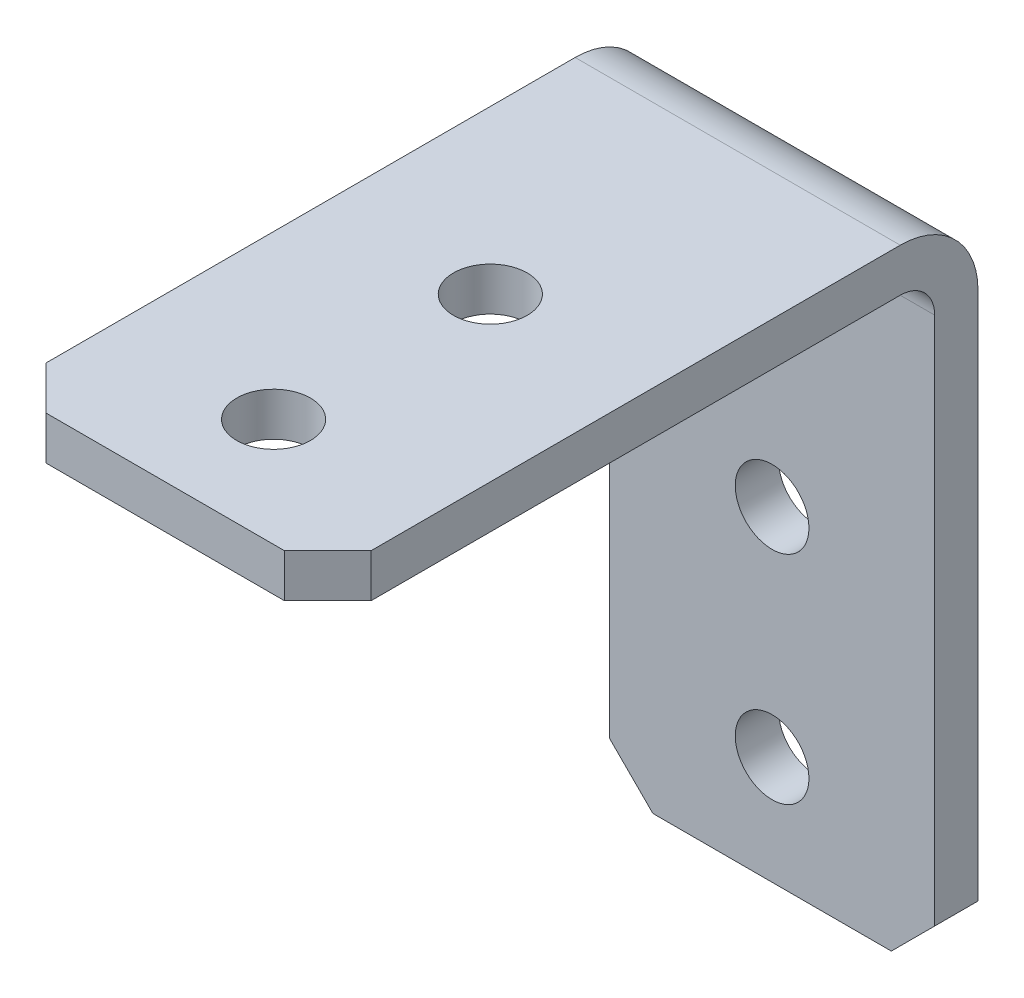
from build123d import *

# Parameters (mm, degrees)
SKETCH1_W                  = 30
SKETCH1_H                  = 30
BOSS_EXTRUDE1_DEPTH        = 15
SKETCH2_W                  = 28
SKETCH2_H                  = 28
CUT_EXTRUDE1_DEPTH         = 36.128336141
F_3_4_3_4_DIAMETER_HOLE1_D = 3.4
F_3_4_3_4_DIAMETER_HOLE2_D = 3.4
CHAMFER1_SIZE              = 2
FILLET1_R                  = 1.5875
FILLET2_R                  = 3.5875


with BuildPart() as part:
    # Sketch1 → Boss-Extrude1 (new body)
    with BuildSketch(Plane(origin=(-7.5, 0, 0), x_dir=(0, -1, 0), z_dir=(-1, 0, 0))):
        with Locations((0, 13)):
            Rectangle(SKETCH1_W, SKETCH1_H)
    extrude(amount=-BOSS_EXTRUDE1_DEPTH)

    # Sketch2 → Cut-Extrude1 (cut, through all)
    with BuildSketch(Plane(origin=(7.5, 0, 0), x_dir=(0, 0, -1), z_dir=(1, 0, 0))):
        with Locations((-14, -1)):
            Rectangle(SKETCH2_W, SKETCH2_H)
    extrude(amount=-CUT_EXTRUDE1_DEPTH, mode=Mode.SUBTRACT)

    # Ø3.4 (3.4) Diameter Hole1 (through all)
    with Locations(Plane.XY):
        with Locations((0, 0), (0, -10)):
            Hole(F_3_4_3_4_DIAMETER_HOLE1_D / 2)

    # Ø3.4 (3.4) Diameter Hole2 (through all)
    with Locations(Plane(origin=(0, 13, 0), x_dir=(-1, 0, 0), z_dir=(0, -1, 0))):
        with Locations((0, -13), (0, -23)):
            Hole(F_3_4_3_4_DIAMETER_HOLE2_D / 2)

    # Chamfer1
    chamfer1_edges = [part.edges().sort_by_distance(p)[0] for p in [
        (7.5, -15, -1),
        (-7.5, 14, 28),
        (7.5, 14, 28),
        (-7.5, -15, -1),
    ]]
    chamfer(chamfer1_edges, length=CHAMFER1_SIZE)

    # Fillet1
    fillet1_edges = [part.edges().sort_by_distance(p)[0] for p in [
        (0, 13, 0),
    ]]
    fillet(fillet1_edges, radius=FILLET1_R)

    # Fillet2
    fillet2_edges = [part.edges().sort_by_distance(p)[0] for p in [
        (0, 15, -2),
    ]]
    fillet(fillet2_edges, radius=FILLET2_R)


solid = part.part
